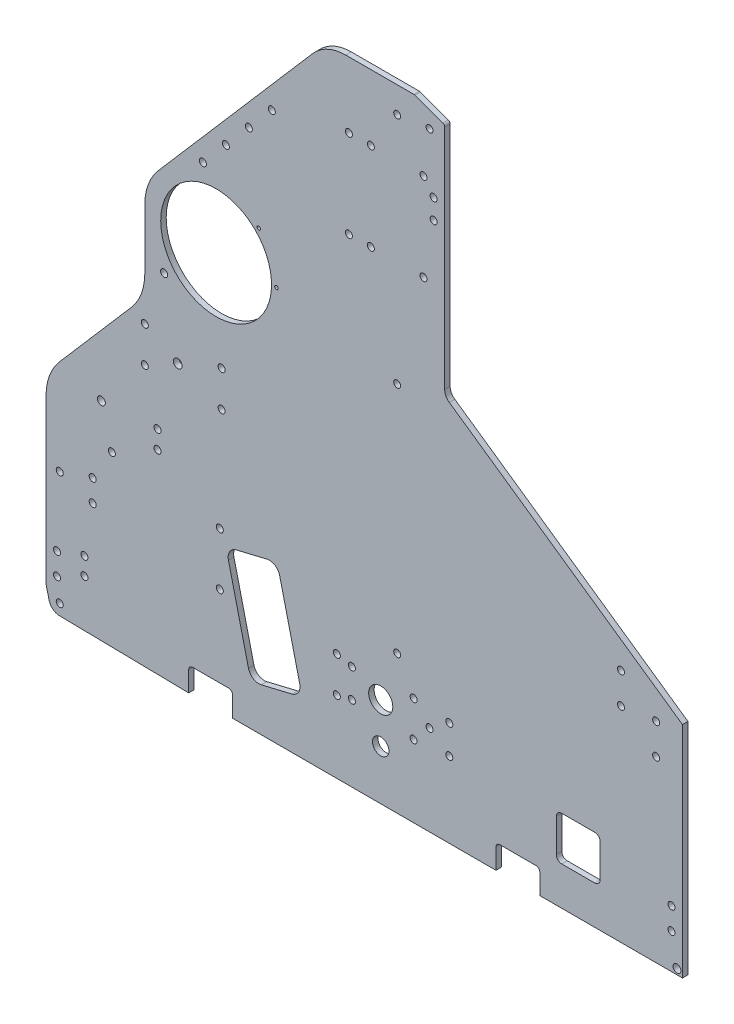
from build123d import *

# Parameters (mm, degrees)
SKETCH1_R           = 2.032
SKETCH1_R_2         = 2.54
SKETCH1_R_3         = 2
BOSS_EXTRUDE1_DEPTH = 3.175
FILLET1_R           = 2.286
FILLET2_R           = 6.35
SKETCH2_R           = 2.032
CUT_EXTRUDE1_DEPTH  = 505.524983177
FILLET3_R           = 1.5875
SKETCH3_R           = 2.032
SKETCH3_R_2         = 2.286
SKETCH3_R_3         = 1.016
CUT_EXTRUDE2_DEPTH  = 505.524983177
SKETCH4_R           = 2.032
SKETCH4_R_2         = 6.985
SKETCH4_R_3         = 4.7625
CUT_EXTRUDE3_DEPTH  = 505.524983177
SKETCH5_R           = 32.0675
SKETCH5_R_2         = 2.286
CUT_EXTRUDE5_DEPTH  = 540.282512158
FILLET4_R           = 31.75
CUT_EXTRUDE6_DEPTH  = 505.524983177
FILLET5_R           = 25.4
SKETCH8_R           = 2.032
CUT_EXTRUDE7_DEPTH  = 505.524983177


with BuildPart() as part:
    # Sketch1 → Boss-Extrude1 (new body)
    with BuildSketch(Plane.XY):
        with BuildLine():
            Line((7.829508682, -19.049081656), (82.55, -20.32))
            Line((82.55, -20.32), (82.55, -6.35))
            Line((82.55, -6.35), (107.95, -6.35))
            Line((107.95, -6.35), (107.95, -20.32))
            Line((107.95, -20.32), (260.35, -20.32))
            Line((260.35, -20.32), (260.35, -6.35))
            Line((260.35, -6.35), (285.75, -6.35))
            Line((285.75, -6.35), (285.75, -20.32))
            Line((285.75, -20.32), (368.3, -20.32))
            Line((368.3, -20.32), (368.3, 106.68))
            Line((368.3, 106.68), (230.66375, 202.565))
            Line((230.66375, 202.565), (230.66375, 338.455))
            Line((230.66375, 338.455), (213.19998, 344.805))
            Line((213.19998, 344.805), (203.2, 344.805))
            Line((203.2, 344.805), (161.925, 344.805))
            Line((161.925, 344.805), (52.720122664, 218.469945827))
            ThreePointArc((52.720122664, 218.469945827), (52.803835479, 218.142145922), (52.832, 217.805))
            ThreePointArc((52.832, 217.805), (52.095493096, 216.239521914), (50.419872403, 215.808871996))
            Line((50.419872403, 215.808871996), (0, 157.48))
            Line((0, 157.48), (0, 0))
            Line((0, 0), (0, -6.35))
            ThreePointArc((0, -6.35), (0.047577015, -7.125863724), (0.189595124, -7.890101219))
            Line((0.189595124, -7.890101219), (1.777095124, -14.240101219))
            ThreePointArc((1.777095124, -14.240101219), (3.987212552, -17.671692778), (7.829508682, -19.049081656))
        make_face()
        with Locations((7.9375, -12.7)):
            Circle(SKETCH1_R, mode=Mode.SUBTRACT)
        with Locations((6.35, 0)):
            Circle(SKETCH1_R, mode=Mode.SUBTRACT)
        with Locations((6.35, 12.7)):
            Circle(SKETCH1_R, mode=Mode.SUBTRACT)
        with Locations((38.1, 78.105)):
            Circle(SKETCH1_R, mode=Mode.SUBTRACT)
        with Locations((57.15, 131.28625)):
            Circle(SKETCH1_R, mode=Mode.SUBTRACT)
        with Locations((57.15, 151.92375)):
            Circle(SKETCH1_R, mode=Mode.SUBTRACT)
        with Locations((76.2, 141.605)):
            Circle(SKETCH1_R_2, mode=Mode.SUBTRACT)
        with Locations((101.6, 131.28625)):
            Circle(SKETCH1_R, mode=Mode.SUBTRACT)
        with Locations((101.6, 151.92375)):
            Circle(SKETCH1_R, mode=Mode.SUBTRACT)
        with Locations((203.2, 59.805)):
            Circle(SKETCH1_R_3, mode=Mode.SUBTRACT)
        with Locations((361.95, 0)):
            Circle(SKETCH1_R, mode=Mode.SUBTRACT)
        with Locations((361.95, 12.7)):
            Circle(SKETCH1_R, mode=Mode.SUBTRACT)
        with Locations((353.06, 82.955052336)):
            Circle(SKETCH1_R, mode=Mode.SUBTRACT)
        with Locations((332.74, 98.195052336)):
            Circle(SKETCH1_R, mode=Mode.SUBTRACT)
        with Locations((332.74, 115.975052336)):
            Circle(SKETCH1_R, mode=Mode.SUBTRACT)
        with Locations((353.06, 100.735052336)):
            Circle(SKETCH1_R, mode=Mode.SUBTRACT)
        with Locations((68.326, 182.923674932)):
            Circle(SKETCH1_R, mode=Mode.SUBTRACT)
        with Locations((76.2, 217.805)):
            Circle(SKETCH1_R, mode=Mode.SUBTRACT)
        with Locations((90.779500502, 249.682)):
            Circle(SKETCH1_R, mode=Mode.SUBTRACT)
        with Locations((104.067838673, 265.054783374)):
            Circle(SKETCH1_R, mode=Mode.SUBTRACT)
        with Locations((117.356176844, 280.427566748)):
            Circle(SKETCH1_R, mode=Mode.SUBTRACT)
        with Locations((130.644515014, 295.800350122)):
            Circle(SKETCH1_R, mode=Mode.SUBTRACT)
        with Locations((203.2, 194.805)):
            Circle(SKETCH1_R_3, mode=Mode.SUBTRACT)
        with Locations((224.31375, 287.401)):
            Circle(SKETCH1_R, mode=Mode.SUBTRACT)
        with Locations((224.31375, 298.831)):
            Circle(SKETCH1_R, mode=Mode.SUBTRACT)
        with Locations((203.2, 329.805)):
            Circle(SKETCH1_R_3, mode=Mode.SUBTRACT)
        with Locations((221.931865, 332.105)):
            Circle(SKETCH1_R_3, mode=Mode.SUBTRACT)
    extrude(amount=BOSS_EXTRUDE1_DEPTH)

    # Fillet1
    fillet1_edges = [part.edges().sort_by_distance(p)[0] for p in [
        (285.75, -6.35, 1.5875),
        (107.95, -6.35, 1.5875),
        (260.35, -6.35, 1.5875),
        (82.55, -6.35, 1.5875),
    ]]
    fillet(fillet1_edges, radius=FILLET1_R)

    # Fillet2
    fillet2_edges = [part.edges().sort_by_distance(p)[0] for p in [
        (230.66375, 202.565, 1.5875),
    ]]
    fillet(fillet2_edges, radius=FILLET2_R)

    # Sketch2 → Cut-Extrude1 (cut, through all)
    with BuildSketch(Plane(origin=(0, 0, 0), x_dir=(-1, 0, 0), z_dir=(0, 0, -1))):
        with Locations((-100.552770272, 71.086035298)):
            Circle(SKETCH2_R)
        with Locations((-100.552770272, 40.606035298)):
            Circle(SKETCH2_R)
        with Locations((-22.225, 18.202541089)):
            Circle(SKETCH2_R)
        with Locations((-22.225, 8.042541089)):
            Circle(SKETCH2_R)
    extrude(amount=-CUT_EXTRUDE1_DEPTH, mode=Mode.SUBTRACT)

    # Fillet3
    fillet3_edges = [part.edges().sort_by_distance(p)[0] for p in [
        (230.66375, 338.455, 1.5875),
        (213.19998, 344.805, 1.5875),
    ]]
    fillet(fillet3_edges, radius=FILLET3_R)

    # Sketch3 → Cut-Extrude2 (cut, through all)
    with BuildSketch(Plane.XY.offset(3.175)):
        with BuildLine():
            Line((127.789350211, 69.359774106), (110.090750339, 65.117184968))
            ThreePointArc((110.090750339, 65.117184968), (106.287939856, 62.356288953), (105.55119507, 57.715047577))
            Line((105.55119507, 57.715047577), (117.160037875, 9.287010566))
            ThreePointArc((117.160037875, 9.287010566), (119.92093389, 5.484200083), (124.562175266, 4.747455297))
            Line((124.562175266, 4.747455297), (142.260775137, 8.990044434))
            ThreePointArc((142.260775137, 8.990044434), (146.063585621, 11.75094045), (146.800330407, 16.392181825))
            Line((146.800330407, 16.392181825), (135.191487602, 64.820218836))
            ThreePointArc((135.191487602, 64.820218836), (132.430591586, 68.62302932), (127.789350211, 69.359774106))
        make_face()
        with Locations((26.987500002, 46.953113935)):
            Circle(SKETCH3_R)
        with Locations((26.987500002, 59.653113935)):
            Circle(SKETCH3_R)
        with Locations((7.937500002, 53.303113935)):
            Circle(SKETCH3_R)
        with Locations((32.030600738, 100.810868776)):
            Circle(SKETCH3_R_2)
        with Locations((64.525942114, 102.94048958)):
            Circle(SKETCH3_R)
        with Locations((64.525942114, 92.525786339)):
            Circle(SKETCH3_R)
        with Locations((133.35, 208.228121768)):
            Circle(SKETCH3_R_3)
        with Locations((123.120704333, 232.923826101)):
            Circle(SKETCH3_R_3)
    extrude(amount=-CUT_EXTRUDE2_DEPTH, mode=Mode.SUBTRACT)

    # Sketch4 → Cut-Extrude3 (cut, through all)
    with BuildSketch(Plane.XY.offset(3.175)):
        with Locations((168.275, 42.06875)):
            Circle(SKETCH4_R)
        with Locations((212.725, 42.06875)):
            Circle(SKETCH4_R)
        with Locations((212.725, 21.43125)):
            Circle(SKETCH4_R)
        with Locations((168.275, 21.43125)):
            Circle(SKETCH4_R)
        with Locations((193.675, 31.75)):
            Circle(SKETCH4_R_2)
        with Locations((177.00498, 40.0431)):
            Circle(SKETCH4_R)
        with Locations((177.00498, 23.4569)):
            Circle(SKETCH4_R)
        with Locations((193.675, 8.466666658)):
            Circle(SKETCH4_R_3)
        with Locations((221.931865, 31.75)):
            Circle(SKETCH4_R)
        with Locations((233.36123, 23.4569)):
            Circle(SKETCH4_R)
        with Locations((233.36123, 40.0431)):
            Circle(SKETCH4_R)
    extrude(amount=-CUT_EXTRUDE3_DEPTH, mode=Mode.SUBTRACT)

    # Sketch5 → Cut-Extrude5 (cut, through all)
    with BuildSketch(Plane(origin=(0, 0, -187.324999723), x_dir=(-1, 0, 0), z_dir=(0, 0, -1))):
        Polygon((0, 157.48), (-57.15, 223.594705882), (-57.15, 165.333696112), (0, 99.218990229), align=None)
        with Locations((-98.425, 208.228121768)):
            Circle(SKETCH5_R)
        with Locations((-365.124993903, -17.144956474)):
            Circle(SKETCH5_R_2)
    extrude(amount=-CUT_EXTRUDE5_DEPTH, mode=Mode.SUBTRACT)

    # Fillet4
    fillet4_edges = [part.edges().sort_by_distance(p)[0] for p in [
        (0, 99.218990229, 1.5875),
        (57.15, 165.333696112, 1.5875),
        (57.15, 223.594705882, 1.5875),
    ]]
    fillet(fillet4_edges, radius=FILLET4_R)

    # Sketch6 → Cut-Extrude6 (cut, through all)
    with BuildSketch(Plane.XY.offset(3.175)):
        with BuildLine():
            Line((298.45, 27.305), (317.5, 27.305))
            ThreePointArc((317.5, 27.305), (319.74506403, 26.37506403), (320.675, 24.13))
            Line((320.675, 24.13), (320.675, 5.08))
            ThreePointArc((320.675, 5.08), (319.74506403, 2.83493597), (317.5, 1.905))
            Line((317.5, 1.905), (298.45, 1.905))
            ThreePointArc((298.45, 1.905), (296.20493597, 2.83493597), (295.275, 5.08))
            Line((295.275, 5.08), (295.275, 24.13))
            ThreePointArc((295.275, 24.13), (296.20493597, 26.37506403), (298.45, 27.305))
        make_face()
    extrude(amount=-CUT_EXTRUDE6_DEPTH, mode=Mode.SUBTRACT)

    # Fillet5
    fillet5_edges = [part.edges().sort_by_distance(p)[0] for p in [
        (161.925, 344.805, 1.5875),
    ]]
    fillet(fillet5_edges, radius=FILLET5_R)

    # Sketch8 → Cut-Extrude7 (cut, through all)
    with BuildSketch(Plane(origin=(0, 0, 0), x_dir=(-1, 0, 0), z_dir=(0, 0, -1))):
        with Locations((-187.96, 306.705)):
            Circle(SKETCH8_R)
        with Locations((-175.26, 306.705)):
            Circle(SKETCH8_R)
        with Locations((-218.44, 306.705)):
            Circle(SKETCH8_R)
        with Locations((-218.44, 255.905)):
            Circle(SKETCH8_R)
        with Locations((-187.96, 255.905)):
            Circle(SKETCH8_R)
        with Locations((-175.26, 255.905)):
            Circle(SKETCH8_R)
    extrude(amount=-CUT_EXTRUDE7_DEPTH, mode=Mode.SUBTRACT)


solid = part.part
